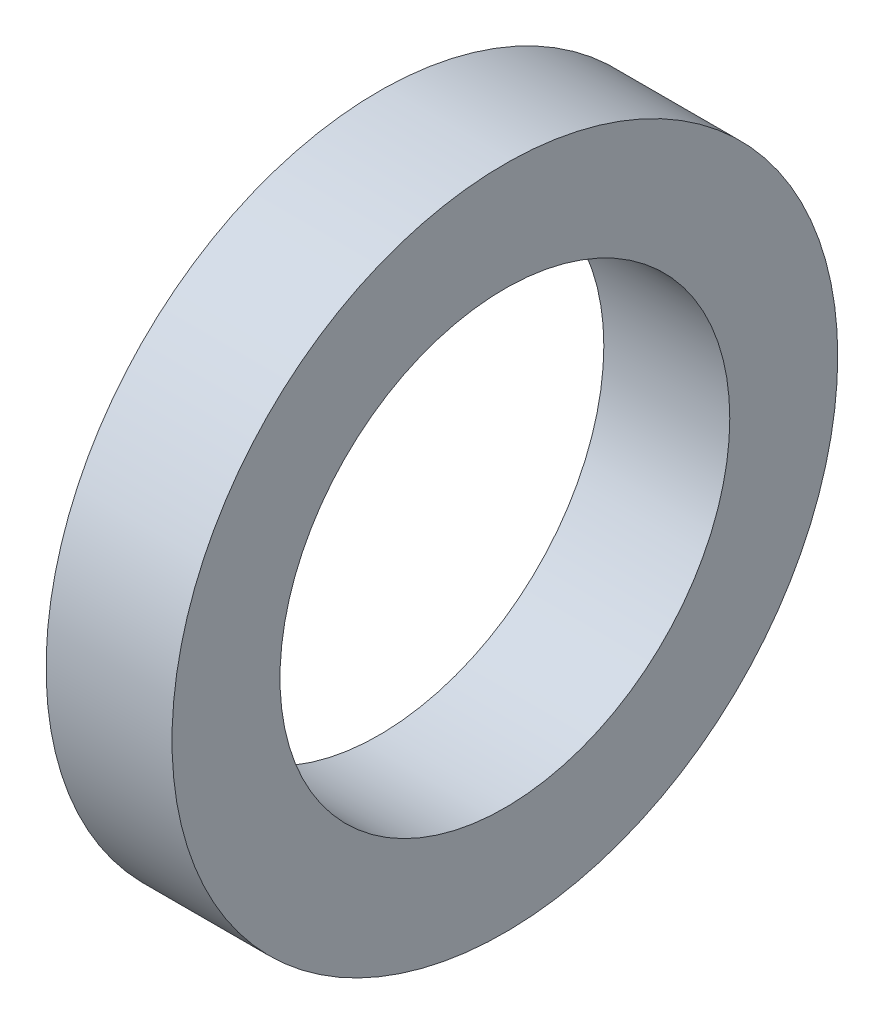
from build123d import *

# Parameters (mm, degrees)
SKETCH1_R           = 18.5
SKETCH1_R_2         = 12.5
BOSS_EXTRUDE1_DEPTH = 3.5


with BuildPart() as part:
    # Sketch1 → Boss-Extrude1 (new, symmetric)
    with BuildSketch(Plane(origin=(0, 0, 0), x_dir=(0, 0, -1), z_dir=(1, 0, 0))):
        Circle(SKETCH1_R)
        Circle(SKETCH1_R_2, mode=Mode.SUBTRACT)
    extrude(amount=BOSS_EXTRUDE1_DEPTH, both=True)


solid = part.part
